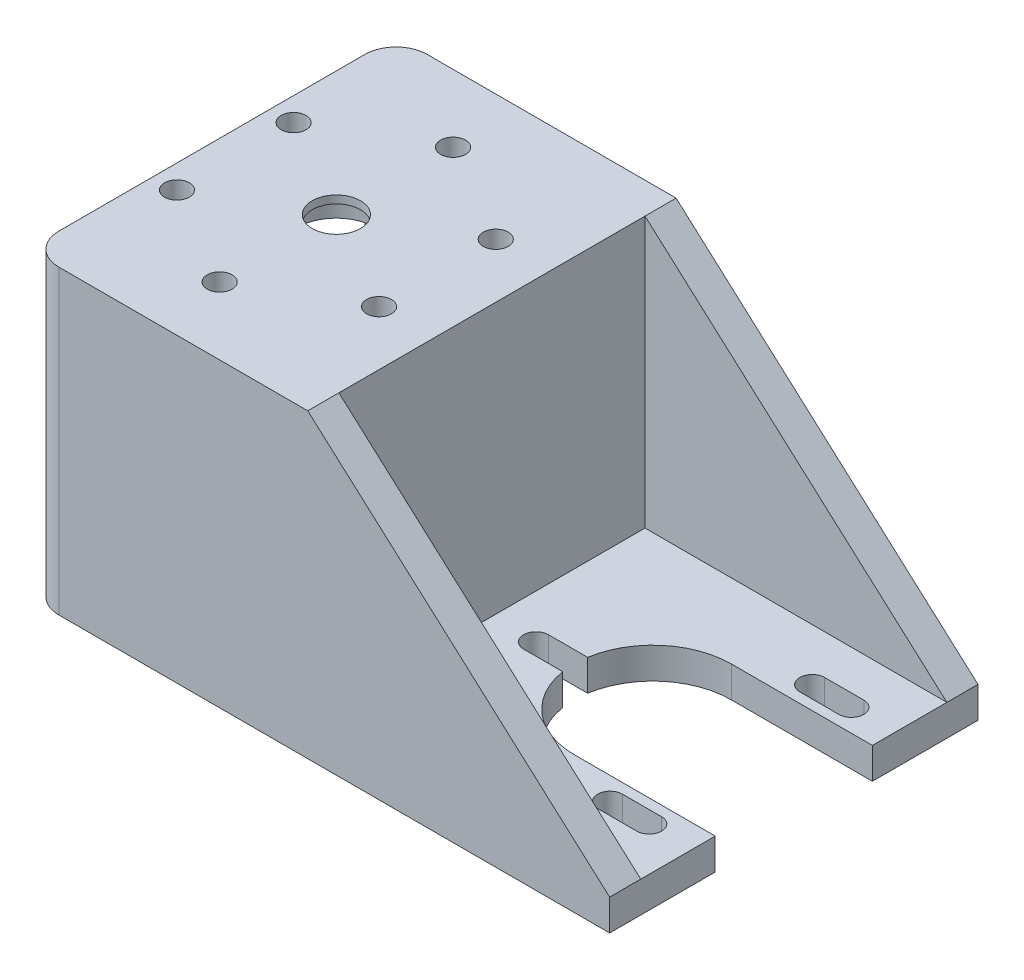
from build123d import *

# Parameters (mm, degrees)
BOSS_EXTRUDE1_DEPTH     = 39.35
CUT_EXTRUDE2_DEPTH      = 33.73
CUT_EXTRUDE2_DEPTH_BACK = 3
SKETCH3_R               = 5.1
CUT_EXTRUDE3_DEPTH      = 33.73
CUT_EXTRUDE4_DEPTH      = 87.647311883
CUT_EXTRUDE4_DEPTH_BACK = 87.647311883
SKETCH3_5_R             = 3.1
SKETCH3_5_R_2           = 10.1
SKETCH3_5_R_3           = 1.6
SKETCH3_5_W             = 20.675
SKETCH3_5_H             = 20.2
SKETCH3_5_W_2           = 5.027537917
SKETCH3_5_H_2           = 3.2
SKETCH3_5_W_3           = 5.03
SKETCH3_6_R             = 1.6
CUT_EXTRUDE5_DEPTH      = 87.647311883
SKETCH4_W               = 77.35
SKETCH4_H               = 38.73
BOSS_EXTRUDE2_DEPTH     = 4
SKETCH5_W               = 77.35
SKETCH5_H               = 38.73
BOSS_EXTRUDE3_DEPTH     = 4
CUT_EXTRUDE6_DEPTH      = 92.909209967
CUT_EXTRUDE6_DEPTH_BACK = 92.909209967
FILLET1_R               = 4


with BuildPart() as part:
    # Sketch1 → Boss-Extrude1 (new body)
    with BuildSketch(Plane.XY):
        Polygon((-68.943174111, 38.106680783), (-32.943174111, 38.106680783), (-32.943174111, 3.376680783), (8.406825889, 3.376680783), (8.406825889, -0.623319217), (-68.943174111, -0.623319217), (-68.943174111, 3.376680783), (-36.943174111, 3.376680783), (-36.943174111, 34.106680783), (-68.943174111, 34.106680783), align=None)
    extrude(amount=BOSS_EXTRUDE1_DEPTH)

    # Sketch3 → Cut-Extrude2 (cut, two sides: drawn at the far end of the back side and taken through both)
    with BuildSketch(Plane(origin=(0, 3.376680783, 0), x_dir=(1, 0, 0), z_dir=(0, 1, 0)).offset(-CUT_EXTRUDE2_DEPTH_BACK)):
        with Locations(Location((-52.943174111, -19.675, 0), (0, 0, 90))):
            Circle(SKETCH3_R)
    extrude(amount=CUT_EXTRUDE2_DEPTH + CUT_EXTRUDE2_DEPTH_BACK, mode=Mode.SUBTRACT)

    # Sketch3<4> → Cut-Extrude3 (cut)
    with BuildSketch(Plane(origin=(0, 3.376680783, 0), x_dir=(1, 0, 0), z_dir=(0, 1, 0))):
        with BuildLine():
            Line((-47.58710279, -20.925), (-45.294644841, -20.925))
            Line((-45.294644841, -20.925), (-45.294644841, -18.425))
            Line((-45.294644841, -18.425), (-47.58710279, -18.425))
            ThreePointArc((-47.58710279, -18.425), (-47.479274758, -19.045870549), (-47.443174111, -19.675))
            ThreePointArc((-47.443174111, -19.675), (-47.479274758, -20.304129451), (-47.58710279, -20.925))
        make_face()
        with BuildLine():
            Line((-60.591703381, -18.425), (-60.591703381, -20.925))
            Line((-60.591703381, -20.925), (-58.299245432, -20.925))
            ThreePointArc((-58.299245432, -20.925), (-58.443174111, -19.675), (-58.299245432, -18.425))
            Line((-58.299245432, -18.425), (-60.591703381, -18.425))
        make_face()
    extrude(amount=CUT_EXTRUDE3_DEPTH, mode=Mode.SUBTRACT)

    # Sketch3<5> → Cut-Extrude4 (cut, two sides: drawn at the far end of the back side and taken through both)
    with BuildSketch(Plane(origin=(0, 3.376680783, 0), x_dir=(1, 0, 0), z_dir=(0, 1, 0)).offset(-CUT_EXTRUDE4_DEPTH_BACK)):
        with Locations(Location((-52.943174111, -19.675, 0), (0, 0, 270))):
            Circle(SKETCH3_5_R)
        with Locations((-12.268174111, -19.675)):
            Circle(SKETCH3_5_R_2)
        with Locations((-4.768174111, -32.665381057)):
            Circle(SKETCH3_5_R_3)
        with Locations((-4.768174111, -6.684618943)):
            Circle(SKETCH3_5_R_3)
        with Locations((-27.268174111, -19.675)):
            Circle(SKETCH3_5_R_3)
        with Locations((0.261825889, -32.665381057)):
            Circle(SKETCH3_5_R_3)
        with Locations((0.261825889, -6.684618943)):
            Circle(SKETCH3_5_R_3)
        with Locations((-1.930674111, -19.675)):
            Rectangle(SKETCH3_5_W, SKETCH3_5_H)
        with Locations((-24.754405152, -19.675)):
            Rectangle(SKETCH3_5_W_2, SKETCH3_5_H_2)
        with Locations((-2.253174111, -32.665381057)):
            Rectangle(SKETCH3_5_W_3, SKETCH3_5_H_2)
        with Locations((-2.253174111, -6.684618943)):
            Rectangle(SKETCH3_5_W_3, SKETCH3_5_H_2)
    extrude(amount=CUT_EXTRUDE4_DEPTH + CUT_EXTRUDE4_DEPTH_BACK, mode=Mode.SUBTRACT)

    # Sketch3<6> → Cut-Extrude5 (cut, through all)
    with BuildSketch(Plane(origin=(0, 3.376680783, 0), x_dir=(1, 0, 0), z_dir=(0, 1, 0))):
        with Locations(Location((-52.943174111, -34.675, 0), (0, 0, 180))):
            Circle(SKETCH3_6_R)
        with Locations(Location((-65.933555168, -27.175, 0), (0, 0, 180))):
            Circle(SKETCH3_6_R)
        with Locations(Location((-65.933555168, -12.175, 0), (0, 0, 180))):
            Circle(SKETCH3_6_R)
        with Locations(Location((-52.943174111, -4.675, 0), (0, 0, 180))):
            Circle(SKETCH3_6_R)
        with Locations(Location((-39.952793054, -12.175, 0), (0, 0, 180))):
            Circle(SKETCH3_6_R)
        with Locations(Location((-39.952793054, -27.175, 0), (0, 0, 180))):
            Circle(SKETCH3_6_R)
    extrude(amount=CUT_EXTRUDE5_DEPTH, mode=Mode.SUBTRACT)

    # Sketch4 → Boss-Extrude2 (add)
    with BuildSketch(Plane.XY.offset(39.35)):
        with Locations((-30.268174111, 18.741680783)):
            Rectangle(SKETCH4_W, SKETCH4_H)
    extrude(amount=BOSS_EXTRUDE2_DEPTH)

    # Sketch5 → Boss-Extrude3 (add)
    with BuildSketch(Plane(origin=(0, 0, 0), x_dir=(-1, 0, 0), z_dir=(0, 0, -1))):
        with Locations((30.268174111, 18.741680783)):
            Rectangle(SKETCH5_W, SKETCH5_H)
    extrude(amount=BOSS_EXTRUDE3_DEPTH)

    # Sketch6 → Cut-Extrude6 (cut, two sides: drawn at the far end of the back side and taken through both)
    with BuildSketch(Plane.XY.offset(43.35).offset(-CUT_EXTRUDE6_DEPTH_BACK)):
        Polygon((-32.943174111, 38.106680783), (5.861825889, 3.376680783), (5.861825889, -0.623319217), (8.406825889, -0.623319217), (8.406825889, 38.106680783), align=None)
    extrude(amount=CUT_EXTRUDE6_DEPTH + CUT_EXTRUDE6_DEPTH_BACK, mode=Mode.SUBTRACT)

    # Fillet1
    fillet1_edges = [part.edges().sort_by_distance(p)[0] for p in [
        (-68.943174111, 18.741680783, 43.35),
        (-68.943174111, 18.741680783, -4),
    ]]
    fillet(fillet1_edges, radius=FILLET1_R - 0.0001)  # a hair under: the kernel refuses the full size


solid = part.part
